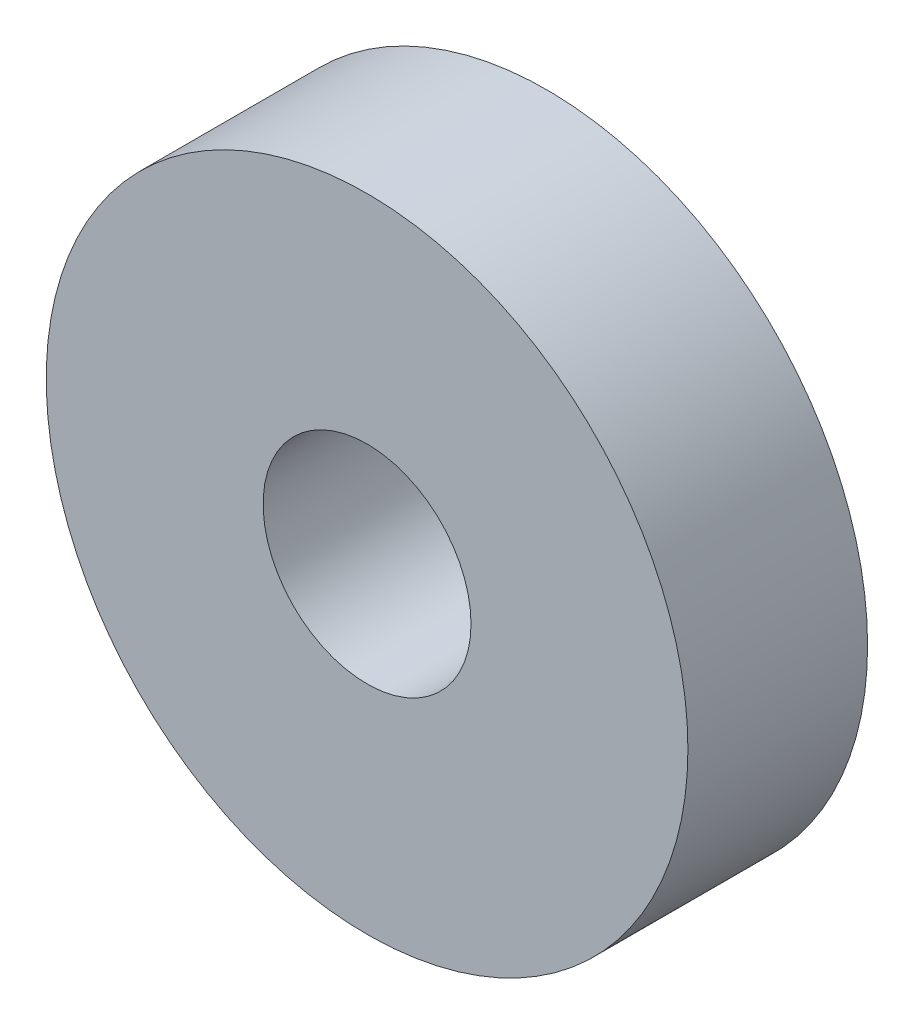
from build123d import *

# Parameters (mm, degrees)
SKETCH1_R           = 3.175
SKETCH1_R_2         = 1.0287
BOSS_EXTRUDE1_DEPTH = 1.778


with BuildPart() as part:
    # Sketch1 → Boss-Extrude1 (new body)
    with BuildSketch(Plane.XY):
        Circle(SKETCH1_R)
        Circle(SKETCH1_R_2, mode=Mode.SUBTRACT)
    extrude(amount=BOSS_EXTRUDE1_DEPTH)


solid = part.part
